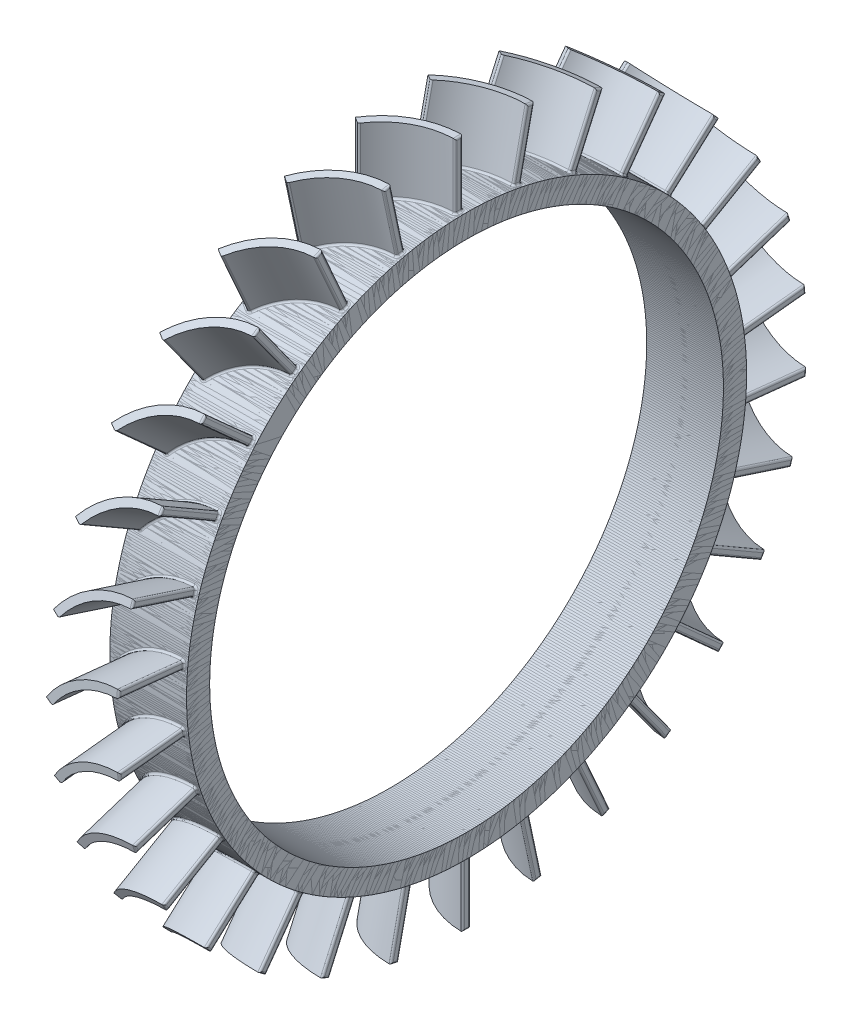
from build123d import *

# Parameters (mm, degrees)
SKETCH1_R               = 73.005
SKETCH1_R_2             = 67.005
BOSS_EXTRUDE1_DEPTH     = 10
EXTRUDE_THIN1_DEPTH     = 90
CUT_EXTRUDE1_DEPTH      = 118.599872711
CUT_EXTRUDE1_DEPTH_BACK = 118.599872711
SKETCH3_R               = 67.005
FILLET1_R               = 0.5
FILLET3_R               = 0.5
CIRPATTERN6_COUNT       = 30


with BuildPart() as part:
    # Sketch1 → Boss-Extrude1 (new, symmetric)
    with BuildSketch(Plane(origin=(0, 0, 0), x_dir=(0, 0, -1), z_dir=(1, 0, 0))):
        Circle(SKETCH1_R)
        Circle(SKETCH1_R_2, mode=Mode.SUBTRACT)
    extrude(amount=BOSS_EXTRUDE1_DEPTH, both=True)

    # Sketch2 → Extrude-Thin1 (add)
    with BuildSketch(Plane(origin=(0, 0, 0), x_dir=(1, 0, 0), z_dir=(0, 1, 0))):
        with BuildLine():
            ThreePointArc((9, 0), (-1.295630141, 2.667865746), (-9, 10))
            Line((-9, 10), (-7.301886792, 11.056603774))
            ThreePointArc((-7.301886792, 11.056603774), (-0.324344279, 4.416180298), (9, 2))
            Line((9, 2), (9, 0))
        make_face()
    extrude(amount=-EXTRUDE_THIN1_DEPTH)

    # Sketch3 → Cut-Extrude1 (cut, two sides: drawn at the far end of the back side and taken through both)
    with BuildSketch(Plane(origin=(10, 0, 0), x_dir=(0, 0, -1), z_dir=(1, 0, 0)).offset(-CUT_EXTRUDE1_DEPTH_BACK)):
        Circle(SKETCH3_R)
    extrude(amount=CUT_EXTRUDE1_DEPTH + CUT_EXTRUDE1_DEPTH_BACK, mode=Mode.SUBTRACT)

    # Fillet1
    fillet1_edges = [part.edges().sort_by_distance(p)[0] for p in [
        (9, -81.5025, 0),
        (9, -81.488799737, -2),
        (-7.301886792, -81.081440998, -11.056603774),
        (9, -90, -1),
    ]]
    fillet(fillet1_edges, radius=FILLET1_R)

    # Fillet3
    fillet3_edges = [part.edges().sort_by_distance(p)[0] for p in [
        (-8.360441644, -72.260727331, -10.397947422),
        (-1.528768472, -72.951311394, -2.799319735),
        (9, -72.998065409, -1.006216483),
        (-0.335296819, -72.870937666, -4.422269723),
        (8.849258631, -73.004849489, -0.148242954),
        (8.858032251, -72.981419911, -1.85536325),
        (-7.349115103, -72.192802294, -10.859526782),
    ]]
    fillet(fillet3_edges, radius=FILLET3_R)


with BuildPart() as cirpattern6_1:
    # CirPattern6: pattern copy
    add(part.part.rotate(Axis((10, 0, 0), (-1, 0, 0)), 1 * 360 / CIRPATTERN6_COUNT))


with BuildPart() as cirpattern6_2:
    # CirPattern6: pattern copy
    add(part.part.rotate(Axis((10, 0, 0), (-1, 0, 0)), 2 * 360 / CIRPATTERN6_COUNT))


with BuildPart() as cirpattern6_3:
    # CirPattern6: pattern copy
    add(part.part.rotate(Axis((10, 0, 0), (-1, 0, 0)), 3 * 360 / CIRPATTERN6_COUNT))


with BuildPart() as cirpattern6_4:
    # CirPattern6: pattern copy
    add(part.part.rotate(Axis((10, 0, 0), (-1, 0, 0)), 4 * 360 / CIRPATTERN6_COUNT))


with BuildPart() as cirpattern6_5:
    # CirPattern6: pattern copy
    add(part.part.rotate(Axis((10, 0, 0), (-1, 0, 0)), 5 * 360 / CIRPATTERN6_COUNT))


with BuildPart() as cirpattern6_6:
    # CirPattern6: pattern copy
    add(part.part.rotate(Axis((10, 0, 0), (-1, 0, 0)), 6 * 360 / CIRPATTERN6_COUNT))


with BuildPart() as cirpattern6_7:
    # CirPattern6: pattern copy
    add(part.part.rotate(Axis((10, 0, 0), (-1, 0, 0)), 7 * 360 / CIRPATTERN6_COUNT))


with BuildPart() as cirpattern6_8:
    # CirPattern6: pattern copy
    add(part.part.rotate(Axis((10, 0, 0), (-1, 0, 0)), 8 * 360 / CIRPATTERN6_COUNT))


with BuildPart() as cirpattern6_9:
    # CirPattern6: pattern copy
    add(part.part.rotate(Axis((10, 0, 0), (-1, 0, 0)), 9 * 360 / CIRPATTERN6_COUNT))


with BuildPart() as cirpattern6_10:
    # CirPattern6: pattern copy
    add(part.part.rotate(Axis((10, 0, 0), (-1, 0, 0)), 10 * 360 / CIRPATTERN6_COUNT))


with BuildPart() as cirpattern6_11:
    # CirPattern6: pattern copy
    add(part.part.rotate(Axis((10, 0, 0), (-1, 0, 0)), 11 * 360 / CIRPATTERN6_COUNT))


with BuildPart() as cirpattern6_12:
    # CirPattern6: pattern copy
    add(part.part.rotate(Axis((10, 0, 0), (-1, 0, 0)), 12 * 360 / CIRPATTERN6_COUNT))


with BuildPart() as cirpattern6_13:
    # CirPattern6: pattern copy
    add(part.part.rotate(Axis((10, 0, 0), (-1, 0, 0)), 13 * 360 / CIRPATTERN6_COUNT))


with BuildPart() as cirpattern6_14:
    # CirPattern6: pattern copy
    add(part.part.rotate(Axis((10, 0, 0), (-1, 0, 0)), 14 * 360 / CIRPATTERN6_COUNT))


with BuildPart() as cirpattern6_15:
    # CirPattern6: pattern copy
    add(part.part.rotate(Axis((10, 0, 0), (-1, 0, 0)), 15 * 360 / CIRPATTERN6_COUNT))


with BuildPart() as cirpattern6_16:
    # CirPattern6: pattern copy
    add(part.part.rotate(Axis((10, 0, 0), (-1, 0, 0)), 16 * 360 / CIRPATTERN6_COUNT))


with BuildPart() as cirpattern6_17:
    # CirPattern6: pattern copy
    add(part.part.rotate(Axis((10, 0, 0), (-1, 0, 0)), 17 * 360 / CIRPATTERN6_COUNT))


with BuildPart() as cirpattern6_18:
    # CirPattern6: pattern copy
    add(part.part.rotate(Axis((10, 0, 0), (-1, 0, 0)), 18 * 360 / CIRPATTERN6_COUNT))


with BuildPart() as cirpattern6_19:
    # CirPattern6: pattern copy
    add(part.part.rotate(Axis((10, 0, 0), (-1, 0, 0)), 19 * 360 / CIRPATTERN6_COUNT))


with BuildPart() as cirpattern6_20:
    # CirPattern6: pattern copy
    add(part.part.rotate(Axis((10, 0, 0), (-1, 0, 0)), 20 * 360 / CIRPATTERN6_COUNT))


with BuildPart() as cirpattern6_21:
    # CirPattern6: pattern copy
    add(part.part.rotate(Axis((10, 0, 0), (-1, 0, 0)), 21 * 360 / CIRPATTERN6_COUNT))


with BuildPart() as cirpattern6_22:
    # CirPattern6: pattern copy
    add(part.part.rotate(Axis((10, 0, 0), (-1, 0, 0)), 22 * 360 / CIRPATTERN6_COUNT))


with BuildPart() as cirpattern6_23:
    # CirPattern6: pattern copy
    add(part.part.rotate(Axis((10, 0, 0), (-1, 0, 0)), 23 * 360 / CIRPATTERN6_COUNT))


with BuildPart() as cirpattern6_24:
    # CirPattern6: pattern copy
    add(part.part.rotate(Axis((10, 0, 0), (-1, 0, 0)), 24 * 360 / CIRPATTERN6_COUNT))


with BuildPart() as cirpattern6_25:
    # CirPattern6: pattern copy
    add(part.part.rotate(Axis((10, 0, 0), (-1, 0, 0)), 25 * 360 / CIRPATTERN6_COUNT))


with BuildPart() as cirpattern6_26:
    # CirPattern6: pattern copy
    add(part.part.rotate(Axis((10, 0, 0), (-1, 0, 0)), 26 * 360 / CIRPATTERN6_COUNT))


with BuildPart() as cirpattern6_27:
    # CirPattern6: pattern copy
    add(part.part.rotate(Axis((10, 0, 0), (-1, 0, 0)), 27 * 360 / CIRPATTERN6_COUNT))


with BuildPart() as cirpattern6_28:
    # CirPattern6: pattern copy
    add(part.part.rotate(Axis((10, 0, 0), (-1, 0, 0)), 28 * 360 / CIRPATTERN6_COUNT))


with BuildPart() as cirpattern6_29:
    # CirPattern6: pattern copy
    add(part.part.rotate(Axis((10, 0, 0), (-1, 0, 0)), 29 * 360 / CIRPATTERN6_COUNT))


solid = Compound([part.part, cirpattern6_1.part, cirpattern6_2.part, cirpattern6_3.part, cirpattern6_4.part, cirpattern6_5.part, cirpattern6_6.part, cirpattern6_7.part, cirpattern6_8.part, cirpattern6_9.part, cirpattern6_10.part, cirpattern6_11.part, cirpattern6_12.part, cirpattern6_13.part, cirpattern6_14.part, cirpattern6_15.part, cirpattern6_16.part, cirpattern6_17.part, cirpattern6_18.part, cirpattern6_19.part, cirpattern6_20.part, cirpattern6_21.part, cirpattern6_22.part, cirpattern6_23.part, cirpattern6_24.part, cirpattern6_25.part, cirpattern6_26.part, cirpattern6_27.part, cirpattern6_28.part, cirpattern6_29.part])
